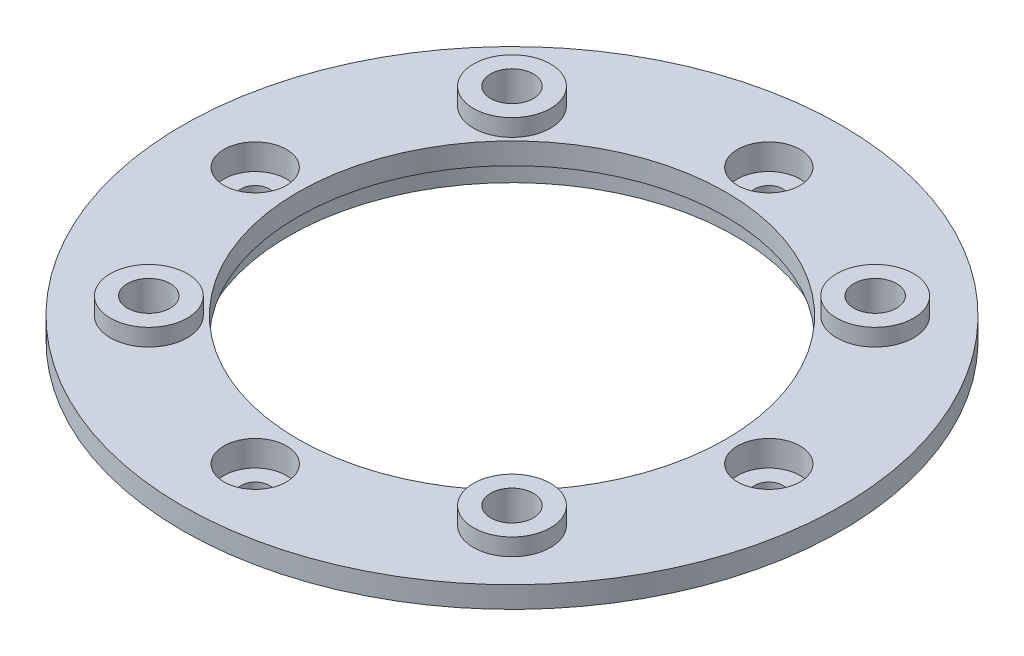
from build123d import *

# Parameters (mm, degrees)
SKETCH1_R           = 34
SKETCH1_R_2         = 26.1
BOSS_EXTRUDE1_DEPTH = 0.5
SKETCH2_R           = 35.5
SKETCH2_R_2         = 26.1
BOSS_EXTRUDE2_DEPTH = 2
SKETCH3_R           = 38.5
SKETCH3_R_2         = 25
BOSS_EXTRUDE3_DEPTH = 2.5
CHAMFER1_SIZE       = 0.5
SKETCH4_R           = 1.65
SKETCH4_R_2         = 2.5
CUT_EXTRUDE1_DEPTH  = 55.676320286
SKETCH6_R           = 3.65
SKETCH6_R_2         = 1.65
CUT_EXTRUDE2_DEPTH  = 3
BOSS_EXTRUDE4_START = 2
SKETCH7_R           = 4.5
SKETCH7_R_2         = 2.5
BOSS_EXTRUDE4_DEPTH = 2


with BuildPart() as part:
    # Sketch1 → Boss-Extrude1 (new body)
    with BuildSketch(Plane(origin=(0, 0, 0), x_dir=(1, 0, 0), z_dir=(0, 1, 0))):
        with Locations(Location((0, 0, 0), (0, 0, 270))):
            Circle(SKETCH1_R)
        with Locations(Location((0, 0, 0), (0, 0, 270))):
            Circle(SKETCH1_R_2, mode=Mode.SUBTRACT)
    extrude(amount=BOSS_EXTRUDE1_DEPTH)

    # Sketch2 → Boss-Extrude2 (add)
    with BuildSketch(Plane(origin=(0, 0.5, 0), x_dir=(1, 0, 0), z_dir=(0, 1, 0))):
        with Locations(Location((0, 0, 0), (0, 0, 270))):
            Circle(SKETCH2_R)
        with Locations(Location((0, 0, 0), (0, 0, 270))):
            Circle(SKETCH2_R_2, mode=Mode.SUBTRACT)
    extrude(amount=BOSS_EXTRUDE2_DEPTH)

    # Sketch3 → Boss-Extrude3 (add)
    with BuildSketch(Plane(origin=(0, 2.5, 0), x_dir=(1, 0, 0), z_dir=(0, 1, 0))):
        with Locations(Location((0, 0, 0), (0, 0, 270))):
            Circle(SKETCH3_R)
        with Locations(Location((0, 0, 0), (0, 0, 270))):
            Circle(SKETCH3_R_2, mode=Mode.SUBTRACT)
    extrude(amount=BOSS_EXTRUDE3_DEPTH)

    # Chamfer1
    chamfer1_edges = [part.edges().sort_by_distance(p)[0] for p in [
        (0, 0.5, -34),
    ]]
    chamfer(chamfer1_edges, length=CHAMFER1_SIZE - 0.0001)  # a hair under: the kernel refuses the full size

    # Sketch4 → Cut-Extrude1 (cut, through all)
    with BuildSketch(Plane(origin=(0, 5, 0), x_dir=(1, 0, 0), z_dir=(0, 1, 0))):
        with Locations(Location((0, 30, 0), (0, 0, 270))):
            Circle(SKETCH4_R)
        with Locations(Location((21.213203436, 21.213203436, 0), (0, 0, 270))):
            Circle(SKETCH4_R_2)
        with Locations(Location((30, 0, 0), (0, 0, 270))):
            Circle(SKETCH4_R)
        with Locations(Location((21.213203436, -21.213203436, 0), (0, 0, 270))):
            Circle(SKETCH4_R_2)
        with Locations(Location((0, -30, 0), (0, 0, 270))):
            Circle(SKETCH4_R)
        with Locations(Location((-21.213203436, -21.213203436, 0), (0, 0, 270))):
            Circle(SKETCH4_R_2)
        with Locations(Location((-30, 0, 0), (0, 0, 270))):
            Circle(SKETCH4_R)
        with Locations(Location((-21.213203436, 21.213203436, 0), (0, 0, 270))):
            Circle(SKETCH4_R_2)
    extrude(amount=-CUT_EXTRUDE1_DEPTH, mode=Mode.SUBTRACT)

    # Sketch6 → Cut-Extrude2 (cut)
    # profile 1 of 4: a face of its own
    with BuildSketch(Plane(origin=(0, 5, 0), x_dir=(1, 0, 0), z_dir=(0, 1, 0))):
        with Locations(Location((0, -30, 0), (0, 0, 270))):
            Circle(SKETCH6_R)
        with Locations(Location((0, -30, 0), (0, 0, 270))):
            Circle(SKETCH6_R_2, mode=Mode.SUBTRACT)
    # profile 2 of 4: a face of its own
    with BuildSketch(Plane(origin=(0, 5, 0), x_dir=(1, 0, 0), z_dir=(0, 1, 0))):
        with Locations(Location((30, 0, 0), (0, 0, 270))):
            Circle(SKETCH6_R)
        with Locations(Location((30, 0, 0), (0, 0, 270))):
            Circle(SKETCH6_R_2, mode=Mode.SUBTRACT)
    # profile 3 of 4: a face of its own
    with BuildSketch(Plane(origin=(0, 5, 0), x_dir=(1, 0, 0), z_dir=(0, 1, 0))):
        with Locations(Location((0, 30, 0), (0, 0, 270))):
            Circle(SKETCH6_R)
        with Locations(Location((0, 30, 0), (0, 0, 270))):
            Circle(SKETCH6_R_2, mode=Mode.SUBTRACT)
    # profile 4 of 4: a face of its own
    with BuildSketch(Plane(origin=(0, 5, 0), x_dir=(1, 0, 0), z_dir=(0, 1, 0))):
        with Locations(Location((-30, 0, 0), (0, 0, 270))):
            Circle(SKETCH6_R)
        with Locations(Location((-30, 0, 0), (0, 0, 270))):
            Circle(SKETCH6_R_2, mode=Mode.SUBTRACT)
    extrude(amount=-CUT_EXTRUDE2_DEPTH, mode=Mode.SUBTRACT)

    # Sketch7 → Boss-Extrude4 (add)
    # profile 1 of 4: a face of its own
    with BuildSketch(Plane(origin=(0, 5, 0), x_dir=(1, 0, 0), z_dir=(0, 1, 0)).offset(BOSS_EXTRUDE4_START)):
        with Locations(Location((-21.213203436, 21.213203436, 0), (0, 0, 270))):
            Circle(SKETCH7_R)
        with Locations(Location((-21.213203436, 21.213203436, 0), (0, 0, 270))):
            Circle(SKETCH7_R_2, mode=Mode.SUBTRACT)
    # profile 2 of 4: a face of its own
    with BuildSketch(Plane(origin=(0, 5, 0), x_dir=(1, 0, 0), z_dir=(0, 1, 0)).offset(BOSS_EXTRUDE4_START)):
        with Locations(Location((21.213203436, 21.213203436, 0), (0, 0, 270))):
            Circle(SKETCH7_R)
        with Locations(Location((21.213203436, 21.213203436, 0), (0, 0, 270))):
            Circle(SKETCH7_R_2, mode=Mode.SUBTRACT)
    # profile 3 of 4: a face of its own
    with BuildSketch(Plane(origin=(0, 5, 0), x_dir=(1, 0, 0), z_dir=(0, 1, 0)).offset(BOSS_EXTRUDE4_START)):
        with Locations(Location((21.213203436, -21.213203436, 0), (0, 0, 270))):
            Circle(SKETCH7_R)
        with Locations(Location((21.213203436, -21.213203436, 0), (0, 0, 270))):
            Circle(SKETCH7_R_2, mode=Mode.SUBTRACT)
    # profile 4 of 4: a face of its own
    with BuildSketch(Plane(origin=(0, 5, 0), x_dir=(1, 0, 0), z_dir=(0, 1, 0)).offset(BOSS_EXTRUDE4_START)):
        with Locations(Location((-21.213203436, -21.213203436, 0), (0, 0, 270))):
            Circle(SKETCH7_R)
        with Locations(Location((-21.213203436, -21.213203436, 0), (0, 0, 270))):
            Circle(SKETCH7_R_2, mode=Mode.SUBTRACT)
    extrude(amount=-BOSS_EXTRUDE4_DEPTH)


solid = part.part
